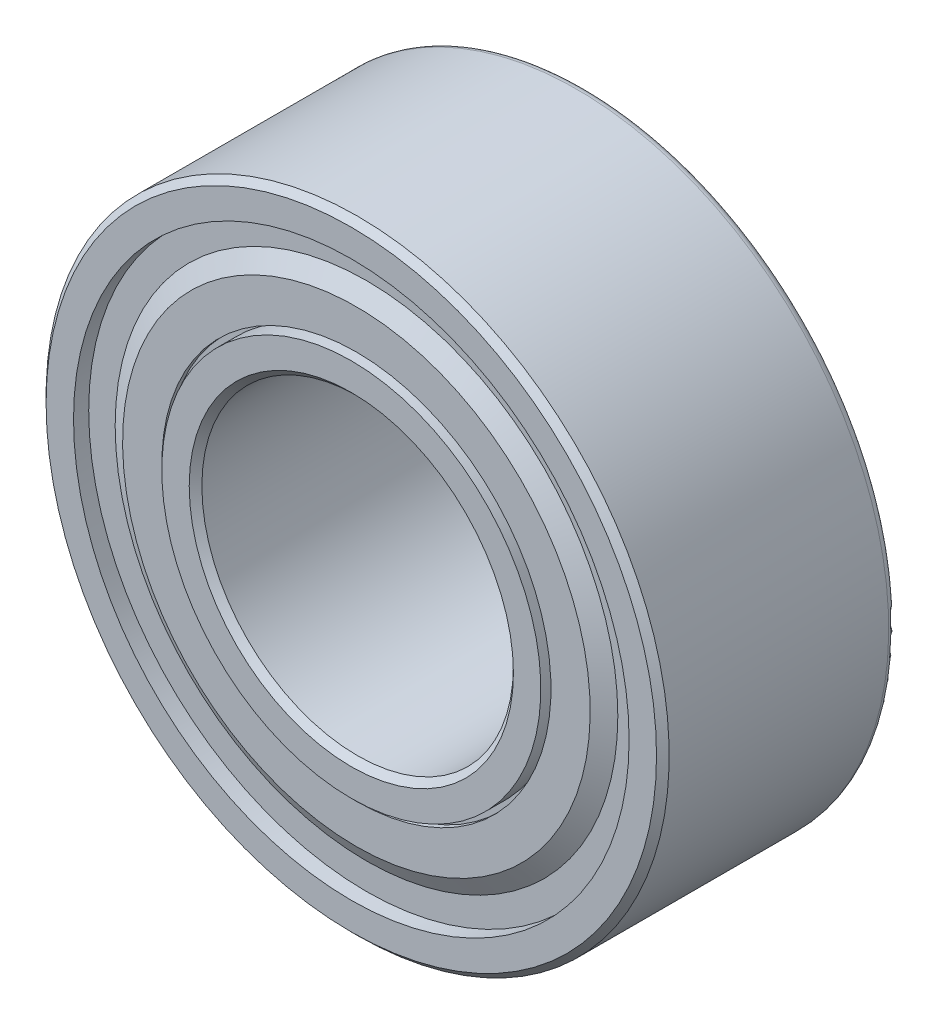
from build123d import *

# Parameters (mm, degrees)
FILLET1_SIZE            = 0.08125
FILLET2_SIZE            = 0.08125
CIRPATTERN3_COUNT       = 12
SKETCH8_W               = 0.26
SKETCH8_H               = 0.216666667
CUT_EXTRUDE1_DEPTH      = 8.163797875
CUT_EXTRUDE1_DEPTH_BACK = 8.163797875
SKETCH10_R              = 4.6
SKETCH10_R_2            = 4
BOSS_EXTRUDE1_START     = 0.397747564
SKETCH11_R              = 4
BOSS_EXTRUDE1_DEPTH     = 0.397747564
CUT_EXTRUDE2_DEPTH      = 7.046281526
CUT_EXTRUDE2_DEPTH_BACK = 7.046281526
SKETCH12_R              = 2
FILLET4_R               = 0.1


with BuildPart() as part:
    # Sketch2 → Revolve1 (revolve)
    with BuildSketch(Plane(origin=(0, 0, 0), x_dir=(0, 0, -1), z_dir=(1, 0, 0)), mode=Mode.PRIVATE) as revolve1_sk:
        with BuildLine():
            Line((1.5, 4.6), (0.9, 4.6))
            Line((0.9, 4.6), (0.9, 4.265165043))
            Line((0.9, 4.265165043), (1.032582521, 4.132582521))
            Line((1.032582521, 4.132582521), (1.032582521, 3.867417479))
            Line((1.032582521, 3.867417479), (0.767417479, 3.867417479))
            Line((0.767417479, 3.867417479), (0.634834957, 4))
            Line((0.634834957, 4), (-1.5, 4))
            Line((-1.5, 4), (-1.5, 3.35))
            Line((-1.5, 3.35), (-0.487339717, 3.35))
            ThreePointArc((-0.487339717, 3.35), (0, 3.6), (0.487339717, 3.35))
            Line((0.487339717, 3.35), (1.5, 3.35))
            Line((1.5, 3.35), (1.5, 4.6))
        make_face()
        with BuildLine():
            Line((1.5, 2), (-1.5, 2))
            Line((-1.5, 2), (-1.5, 2.65))
            Line((-1.5, 2.65), (-0.487339717, 2.65))
            ThreePointArc((-0.487339717, 2.65), (0, 2.4), (0.487339717, 2.65))
            Line((0.487339717, 2.65), (1.5, 2.65))
            Line((1.5, 2.65), (1.5, 2))
        make_face()
    revolve(revolve1_sk.sketch.rotate(Axis((0, 0, 0), (0, 0, -1)), 180), axis=Axis((0, 0, 0), (0, 0, -1)))

    # Fillet1
    fillet1_edges = [part.edges().sort_by_distance(p)[0] for p in [
        (0, 4, 1.5),
        (0, 4.6, -1.5),
        (0, 4.6, -0.9),
    ]]
    chamfer(fillet1_edges, length=FILLET1_SIZE)

    # Fillet2
    fillet2_edges = [part.edges().sort_by_distance(p)[0] for p in [
        (0, 2, -1.5),
        (0, 2, 1.5),
    ]]
    chamfer(fillet2_edges, length=FILLET2_SIZE)

    # Sketch8 → Cut-Revolve1 (revolve, cut)
    with BuildSketch(Plane(origin=(0, 0, 0), x_dir=(0, 0, -1), z_dir=(1, 0, 0)), mode=Mode.PRIVATE) as cut_revolve1_sk:
        with Locations((-1.37, 3.458333334)):
            Rectangle(SKETCH8_W, SKETCH8_H)
        with Locations((1.37, 3.458333334)):
            Rectangle(SKETCH8_W, SKETCH8_H)
        with Locations((1.37, 2.541666667)):
            Rectangle(SKETCH8_W, SKETCH8_H)
        with Locations((-1.37, 2.541666667)):
            Rectangle(SKETCH8_W, SKETCH8_H)
    revolve(cut_revolve1_sk.sketch.rotate(Axis((0, 0, 0), (0, 0, -1)), 180), axis=Axis((0, 0, 0), (0, 0, -1)), mode=Mode.SUBTRACT)

    # Sketch10 → Cut-Extrude1 (cut, two sides: drawn at the far end of the back side and taken through both)
    with BuildSketch(Plane.XY.offset(1.5).offset(-CUT_EXTRUDE1_DEPTH_BACK)):
        Circle(SKETCH10_R)
        with Locations(Location((0, 0, 0), (0, 0, 270))):
            Circle(SKETCH10_R_2, mode=Mode.SUBTRACT)
    extrude(amount=CUT_EXTRUDE1_DEPTH + CUT_EXTRUDE1_DEPTH_BACK, mode=Mode.SUBTRACT)

    # Sketch11 → Boss-Extrude1 (add)
    with BuildSketch(Plane.XY.offset(-1.032582521).offset(BOSS_EXTRUDE1_START)):
        Circle(SKETCH11_R)
    extrude(amount=-BOSS_EXTRUDE1_DEPTH)

    # Sketch12 → Cut-Extrude2 (cut, two sides: drawn at the far end of the back side and taken through both)
    with BuildSketch(Plane.XY.offset(-0.634834957).offset(-CUT_EXTRUDE2_DEPTH_BACK)):
        with Locations(Location((0, 0, 0), (0, 0, 270))):
            Circle(SKETCH12_R)
    extrude(amount=CUT_EXTRUDE2_DEPTH + CUT_EXTRUDE2_DEPTH_BACK, mode=Mode.SUBTRACT)

    # Fillet4
    # the kernel refuses this fillet: 0.1 mm, written as the material it takes off along each edge
    with BuildSketch(Plane(origin=(0, 0, -1.5), x_dir=(0, -1, 0), z_dir=(-1, 0, 0))) as fillet4_piece_1:
        with BuildLine():
            CenterArc((4 - FILLET4_R, FILLET4_R), FILLET4_R, 270, 90)
            Line((4 - FILLET4_R, 0), (4, 0))
            Line((4, 0), (4, FILLET4_R))
        make_face()
    revolve(axis=Axis((0, 0, -1.5), (0, 0, 1)), mode=Mode.SUBTRACT)


with BuildPart() as body_2:
    # Sketch7 → Revolve3 (revolve)
    with BuildSketch(Plane.XY):
        with BuildLine():
            Line((0, 3.6), (0, 2.4))
            ThreePointArc((0, 2.4), (-0.6, 3), (0, 3.6))
        make_face()
    revolve(axis=Axis((0, 3.6, 0), (0, -1, 0)))


with BuildPart() as cirpattern3_1:
    # CirPattern3: pattern copy
    add(body_2.part.rotate(Axis((0, 0, 0), (0, 0, 1)), 1 * 360 / CIRPATTERN3_COUNT))


with BuildPart() as cirpattern3_2:
    # CirPattern3: pattern copy
    add(body_2.part.rotate(Axis((0, 0, 0), (0, 0, 1)), 2 * 360 / CIRPATTERN3_COUNT))


with BuildPart() as cirpattern3_3:
    # CirPattern3: pattern copy
    add(body_2.part.rotate(Axis((0, 0, 0), (0, 0, 1)), 3 * 360 / CIRPATTERN3_COUNT))


with BuildPart() as cirpattern3_4:
    # CirPattern3: pattern copy
    add(body_2.part.rotate(Axis((0, 0, 0), (0, 0, 1)), 4 * 360 / CIRPATTERN3_COUNT))


with BuildPart() as cirpattern3_5:
    # CirPattern3: pattern copy
    add(body_2.part.rotate(Axis((0, 0, 0), (0, 0, 1)), 5 * 360 / CIRPATTERN3_COUNT))


with BuildPart() as cirpattern3_6:
    # CirPattern3: pattern copy
    add(body_2.part.rotate(Axis((0, 0, 0), (0, 0, 1)), 6 * 360 / CIRPATTERN3_COUNT))


with BuildPart() as cirpattern3_7:
    # CirPattern3: pattern copy
    add(body_2.part.rotate(Axis((0, 0, 0), (0, 0, 1)), 7 * 360 / CIRPATTERN3_COUNT))


with BuildPart() as cirpattern3_8:
    # CirPattern3: pattern copy
    add(body_2.part.rotate(Axis((0, 0, 0), (0, 0, 1)), 8 * 360 / CIRPATTERN3_COUNT))


with BuildPart() as cirpattern3_9:
    # CirPattern3: pattern copy
    add(body_2.part.rotate(Axis((0, 0, 0), (0, 0, 1)), 9 * 360 / CIRPATTERN3_COUNT))


with BuildPart() as cirpattern3_10:
    # CirPattern3: pattern copy
    add(body_2.part.rotate(Axis((0, 0, 0), (0, 0, 1)), 10 * 360 / CIRPATTERN3_COUNT))


with BuildPart() as cirpattern3_11:
    # CirPattern3: pattern copy
    add(body_2.part.rotate(Axis((0, 0, 0), (0, 0, 1)), 11 * 360 / CIRPATTERN3_COUNT))


with BuildPart() as body_14:
    # Sketch9 → Revolve4 (revolve)
    with BuildSketch(Plane(origin=(0, 0, 0), x_dir=(0, 0, -1), z_dir=(1, 0, 0)), mode=Mode.PRIVATE) as revolve4_sk:
        Polygon((-1.24, 3.566666667), (-1.24, 3.20952381), (-1.37, 2.984357205), (-1.37, 2.498333333), (-1.435, 2.498333333), (-1.435, 3.001773902), (-1.305, 3.226940507), (-1.305, 3.566666667), align=None)
        Polygon((1.24, 3.566666667), (1.24, 3.20952381), (1.37, 2.984357205), (1.37, 2.498333333), (1.435, 2.498333333), (1.435, 3.001773902), (1.305, 3.226940507), (1.305, 3.566666667), align=None)
    revolve(revolve4_sk.sketch.rotate(Axis((0, 0, 0), (0, 0, -1)), 180), axis=Axis((0, 0, 0), (0, 0, -1)))


solid = Compound([part.part, body_2.part, cirpattern3_1.part, cirpattern3_2.part, cirpattern3_3.part, cirpattern3_4.part, cirpattern3_5.part, cirpattern3_6.part, cirpattern3_7.part, cirpattern3_8.part, cirpattern3_9.part, cirpattern3_10.part, cirpattern3_11.part, body_14.part])
